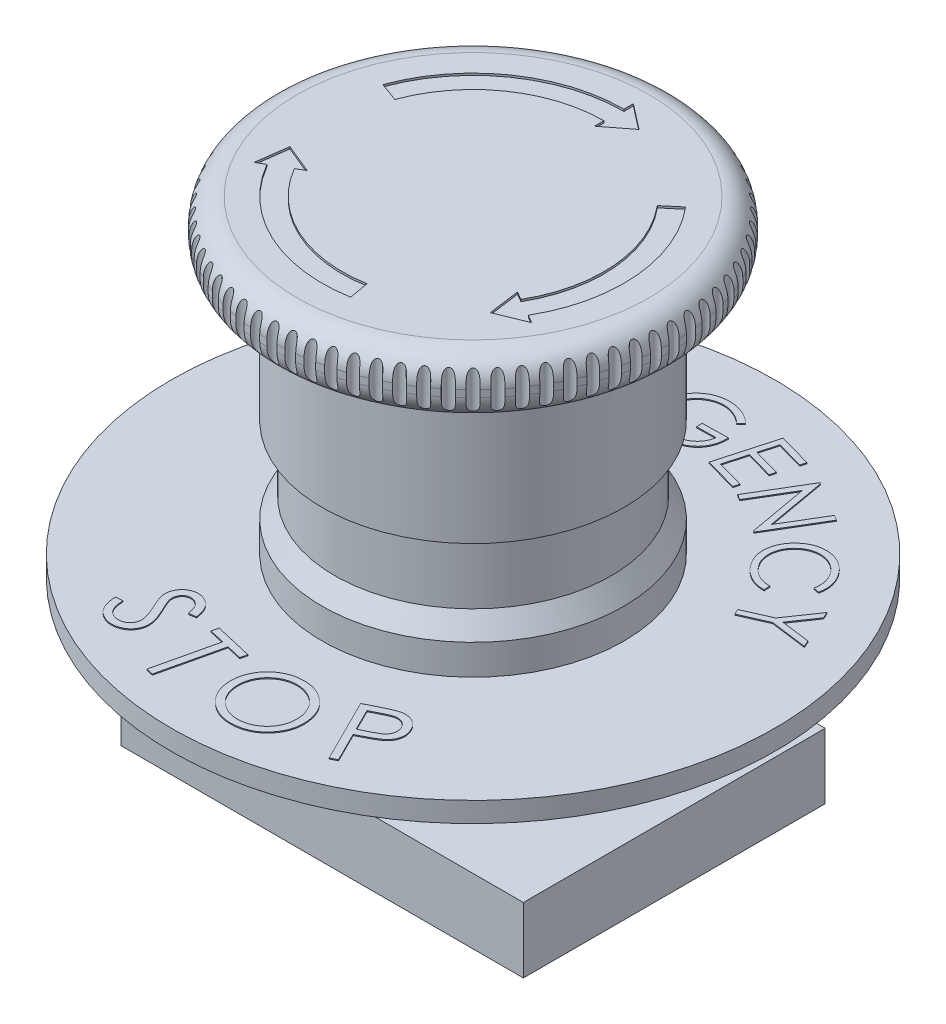
from build123d import *

# Parameters (mm, degrees)
FILLET1_R           = 2.5
CUT_EXTRUDE1_START  = -0.2
CUT_EXTRUDE1_DEPTH  = 0.2
CUT_EXTRUDE5_REACH  = 62.621
CIRPATTERN1_COUNT   = 3
SKETCH3_R           = 0.5
CUT_EXTRUDE2_DEPTH  = 10
CIRPATTERN2_COUNT   = 72
SKETCH4_R           = 0.5
CUT_EXTRUDE3_DEPTH  = 6
CIRPATTERN3_COUNT   = 60
SKETCH5_W           = 4
SKETCH5_H           = 3
CUT_EXTRUDE4_DEPTH  = 6
CIRPATTERN4_COUNT   = 3
SKETCH6_W           = 40
SKETCH6_H           = 30
BOSS_EXTRUDE1_DEPTH = 6.5
BOSS_EXTRUDE2_DEPTH = 0.1
BOSS_EXTRUDE3_DEPTH = 0.1


# Read off the part's stored shape, not the designer's step: Cut-Extrude1
with BuildPart() as part:
    # Sketch1 → Revolve1 (revolve)
    with BuildSketch(Plane.XY):
        Polygon((0, 0), (-20, 0), (-20, -5.7), (-15, -5.7), (-15, -19.3), (-13.75, -19.3), (-13.75, -25.8), (-15, -27.8), (-15, -30.8), (-30, -30.8), (-30, -32.8), (-11, -32.8), (-11, -34.8), (-15, -34.8), (-15, -40.8), (-12, -40.8), (-12, -41.8), (-11, -41.8), (-11, -43.3), (0, -43.3), align=None)
    revolve(axis=Axis((0, 0, 0), (0, -1, 0)))

    # Fillet1
    fillet1_edges = [part.edges().sort_by_distance(p)[0] for p in [
        (20, -5.7, 0),
        (20, 0, 0),
    ]]
    fillet(fillet1_edges, radius=FILLET1_R)

    # Cut-Extrude1 outline → Cut-Extrude1 (cut)
    with BuildSketch(Plane(origin=(0, 0, 0), x_dir=(1, 0, 0), z_dir=(0, 1, 0)).offset(CUT_EXTRUDE1_START)):
        with BuildLine():
            Line((0, 15.934954174), (0, 15))
            ThreePointArc((0, 15), (-8.603646545, 12.287280664), (-14.095389312, 5.13030215))
            Line((-14.095389312, 5.13030215), (-12.21600407, 4.446261863))
            ThreePointArc((-12.21600407, 4.446261863), (-7.456493673, 10.648976576), (0, 13))
            Line((0, 13), (0, 12.065045826))
            Line((0, 12.065045826), (2.5, 14))
            Line((2.5, 14), (0, 15.934954174))
        make_face()
    cut_extrude1 = extrude(amount=CUT_EXTRUDE1_DEPTH, mode=Mode.SUBTRACT)

    # Cut-Extrude5: up to this face of the body (flat: up to its plane)
    cut_extrude5_end = Plane(part.part.faces().sort_by_distance((29.151471863, -32.8, 0))[0])
    # Sketch7 → Cut-Extrude5 (cut, up to the picked face)
    with BuildSketch(Plane.XZ.offset(43.3), mode=Mode.PRIVATE) as cut_extrude5_sk1:
        with BuildLine():
            Line((-10.35, -3.725251669), (-10.35, 3.725251669))
            ThreePointArc((-10.35, 3.725251669), (-11, 0), (-10.35, -3.725251669))
        make_face()
    cut_extrude5_tool1 = split(extrude(cut_extrude5_sk1.sketch, amount=-CUT_EXTRUDE5_REACH, mode=Mode.PRIVATE), bisect_by=cut_extrude5_end, keep=Keep.BOTH, mode=Mode.PRIVATE)
    # Sketch7 → Cut-Extrude5 (cut, up to the picked face)
    with BuildSketch(Plane.XZ.offset(43.3), mode=Mode.PRIVATE) as cut_extrude5_sk2:
        with BuildLine():
            Line((10.35, -3.725251669), (10.35, 3.725251669))
            ThreePointArc((10.35, 3.725251669), (11, 0), (10.35, -3.725251669))
        make_face()
    cut_extrude5_tool2 = split(extrude(cut_extrude5_sk2.sketch, amount=-CUT_EXTRUDE5_REACH, mode=Mode.PRIVATE), bisect_by=cut_extrude5_end, keep=Keep.BOTH, mode=Mode.PRIVATE)
    add(cut_extrude5_tool1.solids().sort_by(Axis((-10.61067, -43.3, 0), (0, 1, 0)))[0], mode=Mode.SUBTRACT)
    add(cut_extrude5_tool2.solids().sort_by(Axis((10.61067, -43.3, 0), (0, 1, 0)))[0], mode=Mode.SUBTRACT)

    # CirPattern1: Cut-Extrude1 ×3 about axis
    cirpattern1_axis = Axis((0, 0, 0), (0, 1, 0))
    for i in range(1, CIRPATTERN1_COUNT):
        add(cut_extrude1.rotate(cirpattern1_axis, i * 360 / CIRPATTERN1_COUNT), mode=Mode.SUBTRACT)

    # Sketch3 → Cut-Extrude2 (cut)
    with BuildSketch(Plane(origin=(0, 0, 0), x_dir=(1, 0, 0), z_dir=(0, 1, 0))):
        with Locations((0, 20)):
            Circle(SKETCH3_R)
    cut_extrude2 = extrude(amount=-CUT_EXTRUDE2_DEPTH, mode=Mode.SUBTRACT)

    # CirPattern2: Cut-Extrude2 ×72 about axis
    cirpattern2_axis = Axis((0, 0, 0), (0, 1, 0))
    for i in range(1, CIRPATTERN2_COUNT):
        add(cut_extrude2.rotate(cirpattern2_axis, i * 360 / CIRPATTERN2_COUNT), mode=Mode.SUBTRACT)

    # Sketch4 → Cut-Extrude3 (cut)
    with BuildSketch(Plane.XZ.offset(40.8)):
        with Locations((0, 15)):
            Circle(SKETCH4_R)
    cut_extrude3 = extrude(amount=-CUT_EXTRUDE3_DEPTH, mode=Mode.SUBTRACT)

    # CirPattern3: Cut-Extrude3 ×60 about axis
    cirpattern3_axis = Axis((0, 0, 0), (0, 1, 0))
    for i in range(1, CIRPATTERN3_COUNT):
        add(cut_extrude3.rotate(cirpattern3_axis, i * 360 / CIRPATTERN3_COUNT), mode=Mode.SUBTRACT)

    # Sketch5 → Cut-Extrude4 (cut)
    with BuildSketch(Plane.XZ.offset(40.8)):
        with Locations((0, 15)):
            Rectangle(SKETCH5_W, SKETCH5_H)
    cut_extrude4 = extrude(amount=-CUT_EXTRUDE4_DEPTH, mode=Mode.SUBTRACT)

    # CirPattern4: Cut-Extrude4 ×3 about axis
    cirpattern4_axis = Axis((0, 0, 0), (0, 1, 0))
    for i in range(1, CIRPATTERN4_COUNT):
        add(cut_extrude4.rotate(cirpattern4_axis, i * 360 / CIRPATTERN4_COUNT), mode=Mode.SUBTRACT)

    # Sketch6 → Boss-Extrude1 (add)
    with BuildSketch(Plane.XZ.offset(43.3)):
        Rectangle(SKETCH6_W, SKETCH6_H)
    extrude(amount=BOSS_EXTRUDE1_DEPTH)

    # Sketch8 → Boss-Extrude2 (add)
    # profile 1 of 9: a face of its own
    with BuildSketch(Plane(origin=(0, -30.8, 0), x_dir=(1, 0, 0), z_dir=(0, 1, 0))):
        Polygon((22.727560882, 12.460487758), (23.006407036, 11.828276219), (21.369387805, 9.436449296), (24.229964728, 9.054237758), (24.508810882, 8.422026219), (20.888618575, 8.895583912), (18.274435882, 7.742939681), (18.036455113, 8.282603142), (20.650637805, 9.435247373), align=None)
    # profile 2 of 9: a face of its own
    with BuildSketch(Plane(origin=(0, -30.8, 0), x_dir=(1, 0, 0), z_dir=(0, 1, 0))):
        with BuildLine():
            Line((20.545172736, 13.787310208), (19.96464389, 13.909906362))
            add(Edge.make_bspline(
                [(19.96464389, 13.909906362), (19.983326679, 14.012957622), (20.020196857, 14.216327592), (20.02884491, 14.523745965), (20.005861256, 14.825519642), (19.954834093, 15.071831993), (19.89780064, 15.264751914), (19.845367531, 15.40680378), (19.786950657, 15.547030328), (19.718209738, 15.683684602), (19.640932728, 15.817577581), (19.555290242, 15.948630989), (19.462059043, 16.077549527), (19.393432794, 16.159502614), (19.358874659, 16.200771747)],
                knots=[0, 0, 0, 0, 1.531837108, 3.023055415, 4.488707286, 5.955814668, 6.696507836, 7.433380089, 8.172211865, 8.920028135, 9.671792873, 10.435032477, 11.211928984, 12, 12, 12, 12], degree=3))
            add(Edge.make_bspline(
                [(19.358874659, 16.200771747), (19.319764534, 16.244958269), (19.242148721, 16.332648424), (19.116512989, 16.454450548), (18.98425618, 16.565747833), (18.846982155, 16.668715224), (18.703169705, 16.761058462), (18.554567054, 16.845958911), (18.398454642, 16.91872941), (18.238619355, 16.983689283), (18.075112063, 17.037531656), (17.911049863, 17.081074632), (17.746323399, 17.112261337), (17.582162247, 17.133132185), (17.417466534, 17.141108995), (17.253188104, 17.139283472), (17.088613558, 17.124166392), (16.924767499, 17.099265604), (16.762479765, 17.063299127), (16.603169442, 17.016008205), (16.447105462, 16.958796616), (16.294903568, 16.889305653), (16.145290706, 16.810514457), (16.000381131, 16.717893213), (15.856576628, 16.61815952), (15.766190909, 16.54281683), (15.720653506, 16.504858285)],
                knots=[0, 0, 0, 0, 1.042701479, 2.069288294, 3.089308805, 4.096267449, 5.099959046, 6.108286196, 7.118749477, 8.14178886, 9.156189653, 10.159256558, 11.139748502, 12.117321014, 13.081646708, 14.051882205, 15.018674707, 16.000137866, 16.979427239, 17.954097297, 18.93540717, 19.914696543, 20.909405144, 21.92123219, 22.952691994, 24, 24, 24, 24], degree=3))
            add(Edge.make_bspline(
                [(15.720653506, 16.504858285), (15.654641031, 16.445101151), (15.52486077, 16.327618863), (15.351758298, 16.134116749), (15.204080667, 15.929373485), (15.078187008, 15.715048905), (14.978936627, 15.489174595), (14.901053555, 15.253514308), (14.848248453, 15.006881625), (14.820285911, 14.752445501), (14.814384652, 14.495589354), (14.836958531, 14.242039427), (14.881940699, 13.993614396), (14.955290735, 13.751649046), (15.051517792, 13.513996009), (15.175584802, 13.283545812), (15.321811378, 13.056511725), (15.437919739, 12.915611931), (15.497095813, 12.843800593)],
                knots=[0, 0, 0, 0, 1.041479286, 2.0475441, 3.031295287, 3.991402464, 4.950593464, 5.912793116, 6.891200925, 7.896129016, 8.904289028, 9.892443154, 10.86991821, 11.853356541, 12.845860858, 13.865154868, 14.91194955, 16, 16, 16, 16], degree=3))
            add(Edge.make_bspline(
                [(15.497095813, 12.843800593), (15.566009219, 12.767680745), (15.701534357, 12.617983417), (15.92987155, 12.423665586), (16.17261508, 12.258562042), (16.431661399, 12.124918896), (16.70473803, 12.019405025), (16.993071472, 11.945030664), (17.296147185, 11.899809297), (17.503348609, 11.89375765), (17.608874659, 11.890675593)],
                knots=[0, 0, 0, 0, 1.028140021, 2.021940653, 2.996345951, 3.964277496, 4.936595987, 5.924074518, 6.942747538, 8, 8, 8, 8], degree=3))
            Line((17.608874659, 11.890675593), (17.643730429, 11.300531362))
            add(Edge.make_bspline(
                [(17.643730429, 11.300531362), (17.583626056, 11.298915051), (17.464157685, 11.295702338), (17.285632114, 11.305344968), (17.108772043, 11.322016818), (16.934273954, 11.353779353), (16.760326627, 11.390859033), (16.588659567, 11.442530651), (16.417772853, 11.50204108), (16.249516982, 11.572988514), (16.084854623, 11.655034226), (15.923646759, 11.746627207), (15.765685903, 11.847207477), (15.613750409, 11.959640724), (15.464240684, 12.079956486), (15.321393062, 12.212848085), (15.179335098, 12.352816309), (15.091027704, 12.453796953), (15.046374659, 12.504858285)],
                knots=[0, 0, 0, 0, 0.972473338, 1.932967617, 2.890855097, 3.844697871, 4.800960732, 5.767126069, 6.743050352, 7.727911838, 8.719407467, 9.718061393, 10.726868225, 11.747292938, 12.774919797, 13.830207265, 14.902834212, 16, 16, 16, 16], degree=3))
            add(Edge.make_bspline(
                [(15.046374659, 12.504858285), (15.004973847, 12.554113181), (14.923038858, 12.651591929), (14.811080103, 12.803252534), (14.706410095, 12.95485731), (14.613699406, 13.108999287), (14.526872486, 13.262647343), (14.45299991, 13.41933738), (14.387291994, 13.577151646), (14.332957392, 13.736910886), (14.284780597, 13.896844199), (14.249570936, 14.058975015), (14.220937535, 14.222026478), (14.205044719, 14.387179978), (14.19615967, 14.553214195), (14.197156589, 14.720619181), (14.209528238, 14.889113398), (14.224127936, 15.001312619), (14.231470813, 15.057742901)],
                knots=[0, 0, 0, 0, 1.114937038, 2.206535296, 3.265851805, 4.306708869, 5.32311974, 6.323246709, 7.307163327, 8.284392244, 9.246829816, 10.2003583, 11.158150331, 12.114430853, 13.073933048, 14.03917219, 15.013807182, 16, 16, 16, 16], degree=3))
            add(Edge.make_bspline(
                [(14.231470813, 15.057742901), (14.248090833, 15.152299009), (14.281051873, 15.339823919), (14.362058535, 15.612384257), (14.464998533, 15.874890425), (14.595385655, 16.125305558), (14.746149154, 16.367279156), (14.925242252, 16.595366888), (15.124216309, 16.816477034), (15.274206337, 16.95013022), (15.350461198, 17.018079439)],
                knots=[0, 0, 0, 0, 0.997790707, 1.97883157, 2.951456285, 3.926113916, 4.911075921, 5.912063291, 6.938493935, 8, 8, 8, 8], degree=3))
            add(Edge.make_bspline(
                [(15.350461198, 17.018079439), (15.43323492, 17.086034246), (15.596140657, 17.219775094), (15.860778721, 17.385996073), (16.131711544, 17.526439427), (16.413438709, 17.633390127), (16.70338872, 17.710757134), (17.001851808, 17.758195606), (17.309166158, 17.772668682), (17.621794773, 17.759736401), (17.933595662, 17.717377207), (18.236452473, 17.643221859), (18.528366678, 17.542163103), (18.808219317, 17.4108577), (19.07516917, 17.247958595), (19.330546837, 17.057172491), (19.575058618, 16.838034199), (19.723338522, 16.672971449), (19.798778506, 16.588992901)],
                knots=[0, 0, 0, 0, 1.029061165, 2.025280033, 2.998925284, 3.959985058, 4.917066297, 5.880594682, 6.860585689, 7.871010548, 8.886214313, 9.881516199, 10.864925191, 11.852612581, 12.848473702, 13.867261507, 14.914932158, 16, 16, 16, 16], degree=3))
            add(Edge.make_bspline(
                [(19.798778506, 16.588992901), (19.843126523, 16.536243368), (19.930857458, 16.431892237), (20.049260673, 16.267666034), (20.157734627, 16.101731664), (20.255892111, 15.93333808), (20.340816201, 15.761067087), (20.415959784, 15.586307484), (20.479386722, 15.408373214), (20.532673712, 15.228350081), (20.572997744, 15.047092098), (20.603421779, 14.865779708), (20.62291119, 14.685179955), (20.629747212, 14.504515905), (20.626721229, 14.324633001), (20.610391515, 14.144886869), (20.584544539, 13.965355329), (20.558342108, 13.846864055), (20.545172736, 13.787310208)],
                knots=[0, 0, 0, 0, 1.097129198, 2.170382686, 3.221543189, 4.253494677, 5.272126005, 6.278272624, 7.281258565, 8.278607594, 9.266133113, 10.236359277, 11.205157895, 12.156573366, 13.113789944, 14.068046391, 15.028997966, 16, 16, 16, 16], degree=3))
        make_face()
    # profile 3 of 9: a face of its own
    with BuildSketch(Plane(origin=(0, -30.8, 0), x_dir=(1, 0, 0), z_dir=(0, 1, 0))):
        Polygon((8.132120265, 18.162872224), (11.207841418, 23.301093378), (11.319620265, 23.233785685), (12.380918342, 17.256622224), (14.735485649, 21.189314531), (15.242697188, 20.885227993), (12.166976034, 15.747006839), (12.051591418, 15.816718378), (10.989091418, 21.728977993), (8.663370265, 17.844362608), align=None)
    # profile 4 of 9: a face of its own
    with BuildSketch(Plane(origin=(0, -30.8, 0), x_dir=(1, 0, 0), z_dir=(0, 1, 0))):
        Polygon((5.534579878, 25.28900762), (8.827849109, 24.362324928), (8.669195263, 23.796219158), (5.950445263, 24.560642235), (5.444435647, 22.763767235), (8.139147186, 22.006555697), (7.981695263, 21.444055697), (5.286983724, 22.201267235), (4.65236834, 19.946459543), (7.347079878, 19.189248005), (7.188426032, 18.623142235), (3.919195263, 19.542613389), align=None)
    # profile 5 of 9: a face of its own
    with BuildSketch(Plane(origin=(0, -30.8, 0), x_dir=(1, 0, 0), z_dir=(0, 1, 0))):
        with BuildLine():
            Line((2.415007403, 24.690552498), (1.961882403, 24.244639036))
            add(Edge.make_bspline(
                [(1.961882403, 24.244639036), (1.876335867, 24.321649294), (1.708180307, 24.473025418), (1.434606461, 24.668655641), (1.151063208, 24.8351032), (0.857950985, 24.970257451), (0.562433704, 25.076521998), (0.268056216, 25.149764114), (-0.02228171, 25.194587624), (-0.214646216, 25.197517442), (-0.309752213, 25.198965959)],
                knots=[0, 0, 0, 0, 1.093719991, 2.149883634, 3.191318574, 4.215648269, 5.214500914, 6.172598825, 7.0965235, 8, 8, 8, 8], degree=3))
            add(Edge.make_bspline(
                [(-0.309752213, 25.198965959), (-0.367896472, 25.196936565), (-0.483673697, 25.192895623), (-0.655893585, 25.173066022), (-0.825715446, 25.143116524), (-0.993147796, 25.102169654), (-1.158419019, 25.050049998), (-1.321614147, 24.987969118), (-1.482280846, 24.913839245), (-1.639527317, 24.830320972), (-1.79201568, 24.738760366), (-1.935087876, 24.637026543), (-2.070103133, 24.529262897), (-2.195296557, 24.413101328), (-2.312723029, 24.290692527), (-2.419379849, 24.158933911), (-2.518324463, 24.020830698), (-2.607064028, 23.875785509), (-2.684487917, 23.725414032), (-2.7535796, 23.573427296), (-2.809990874, 23.418966245), (-2.855823269, 23.262733985), (-2.892396103, 23.104763396), (-2.915903438, 22.944368222), (-2.929896201, 22.782558217), (-2.929928352, 22.674154379), (-2.92994452, 22.619639036)],
                knots=[0, 0, 0, 0, 1.026082329, 2.043141775, 3.055301837, 4.066745937, 5.081666351, 6.110811546, 7.145041362, 8.201116278, 9.250880547, 10.280438288, 11.295998425, 12.296391959, 13.29130206, 14.28593594, 15.284254822, 16.28676855, 17.282607196, 18.266534916, 19.230327222, 20.180861924, 21.137656846, 22.088296662, 23.038621104, 24, 24, 24, 24], degree=3))
            add(Edge.make_bspline(
                [(-2.92994452, 22.619639036), (-2.92802964, 22.563883056), (-2.924215364, 22.452821961), (-2.902669093, 22.287874849), (-2.871914312, 22.124654211), (-2.828064936, 21.964368856), (-2.775295473, 21.805446962), (-2.710304726, 21.649750284), (-2.633982676, 21.496001827), (-2.546892733, 21.345838692), (-2.45001678, 21.200679076), (-2.343540605, 21.063354032), (-2.230015284, 20.9331979), (-2.106177663, 20.812883823), (-1.97529241, 20.699084425), (-1.834431356, 20.59521474), (-1.68619458, 20.498426289), (-1.530268211, 20.411187213), (-1.368281741, 20.332848899), (-1.201402837, 20.266144249), (-1.03121072, 20.20848678), (-0.856842042, 20.165155814), (-0.679688756, 20.129643071), (-0.498672095, 20.10535585), (-0.313923808, 20.093704831), (-0.189573395, 20.093366709), (-0.127059905, 20.093196728)],
                knots=[0, 0, 0, 0, 0.956776184, 1.905815506, 2.850937646, 3.804795088, 4.754804964, 5.722533489, 6.697123525, 7.698194073, 8.699193805, 9.689227377, 10.678042946, 11.660024214, 12.649508676, 13.651829486, 14.660518928, 15.685475604, 16.715514723, 17.745714415, 18.767461491, 19.796215127, 20.826254245, 21.866565476, 22.92747893, 24, 24, 24, 24], degree=3))
            add(Edge.make_bspline(
                [(-0.127059905, 20.093196728), (-0.051639403, 20.095912468), (0.096528425, 20.101247691), (0.313468409, 20.131173294), (0.521522188, 20.175069213), (0.72010844, 20.236623555), (0.90989018, 20.313912089), (1.090586893, 20.406593326), (1.262462503, 20.514999362), (1.422228025, 20.640294702), (1.571647179, 20.7759809), (1.703286128, 20.924329136), (1.820483042, 21.0805819), (1.919952957, 21.246660723), (2.004125173, 21.422262086), (2.068937811, 21.60762171), (2.121402244, 21.801443138), (2.140744319, 21.935071142), (2.150584326, 22.003052498)],
                knots=[0, 0, 0, 0, 1.111322291, 2.18325531, 3.221787674, 4.241238233, 5.242044044, 6.237333614, 7.229730685, 8.231006411, 9.225297705, 10.19935501, 11.148555009, 12.09914895, 13.047044863, 14.012334143, 14.988803126, 16, 16, 16, 16], degree=3))
            Line((2.150584326, 22.003052498), (0.247940095, 21.966994805))
            Line((0.247940095, 21.966994805), (0.237122787, 22.542715959))
            Line((0.237122787, 22.542715959), (2.809238172, 22.591994805))
            add(Edge.make_bspline(
                [(2.809238172, 22.591994805), (2.808337059, 22.479724076), (2.806575428, 22.260240381), (2.77193307, 21.939389359), (2.714392314, 21.63521633), (2.627943666, 21.349030915), (2.519279326, 21.079154689), (2.382335011, 20.827276367), (2.218924517, 20.593529917), (2.033071612, 20.377061515), (1.825237093, 20.182227455), (1.597572522, 20.011944224), (1.353048714, 19.865596038), (1.089417634, 19.746352259), (0.809338941, 19.651146108), (0.51077164, 19.583460212), (0.195588585, 19.537898807), (-0.021131557, 19.529154919), (-0.131867597, 19.524687113)],
                knots=[0, 0, 0, 0, 1.123271213, 2.195939376, 3.225495687, 4.21770229, 5.183624953, 6.132945456, 7.080807812, 8.033443192, 8.983948907, 9.92639992, 10.874168946, 11.83072162, 12.817401472, 13.830104492, 14.891263015, 16, 16, 16, 16], degree=3))
            add(Edge.make_bspline(
                [(-0.131867597, 19.524687113), (-0.199983165, 19.524014852), (-0.334688775, 19.522685385), (-0.534107021, 19.532399443), (-0.728037708, 19.552388702), (-0.916819972, 19.577793025), (-1.100519154, 19.614365329), (-1.278712975, 19.659563451), (-1.451785572, 19.714468084), (-1.620031592, 19.776116594), (-1.782558596, 19.848943347), (-1.940236194, 19.929547879), (-2.093270958, 20.01817633), (-2.240344156, 20.11732338), (-2.381553978, 20.225428502), (-2.518323314, 20.341352786), (-2.649815607, 20.466350054), (-2.732142915, 20.556241082), (-2.77369452, 20.60161019)],
                knots=[0, 0, 0, 0, 1.10830844, 2.191795069, 3.246598796, 4.280154492, 5.290229273, 6.292722341, 7.27007637, 8.243726883, 9.206865609, 10.166135182, 11.124407305, 12.082745958, 13.050265661, 14.016928346, 14.99911934, 16, 16, 16, 16], degree=3))
            add(Edge.make_bspline(
                [(-2.77369452, 20.60161019), (-2.834306001, 20.67350574), (-2.954042481, 20.815533619), (-3.108962132, 21.044199387), (-3.242294451, 21.280706005), (-3.352223608, 21.52642293), (-3.437445084, 21.781916316), (-3.50158814, 22.045486165), (-3.541919552, 22.318370719), (-3.549773105, 22.503321275), (-3.553742597, 22.596802498)],
                knots=[0, 0, 0, 0, 1.030383601, 2.035497289, 3.022734579, 4.003904648, 4.981775465, 5.971491611, 6.974712762, 8, 8, 8, 8], degree=3))
            add(Edge.make_bspline(
                [(-3.553742597, 22.596802498), (-3.553851536, 22.666936935), (-3.554067845, 22.806195599), (-3.538331875, 23.013523992), (-3.507557638, 23.216844606), (-3.466041401, 23.417501193), (-3.409368872, 23.614201243), (-3.339080185, 23.807570599), (-3.256109935, 23.99751022), (-3.160542271, 24.183237241), (-3.052018309, 24.361697364), (-2.935033027, 24.532971829), (-2.805575012, 24.692905285), (-2.667160897, 24.843537329), (-2.518910044, 24.984871227), (-2.359890262, 25.115694962), (-2.191090203, 25.237668521), (-2.012777336, 25.348863155), (-1.826048435, 25.448768875), (-1.632676921, 25.53672338), (-1.432427221, 25.610977199), (-1.226343613, 25.674080355), (-1.013441176, 25.723208574), (-0.794160976, 25.758681509), (-0.569106663, 25.783746942), (-0.416789077, 25.788906262), (-0.33980029, 25.791514036)],
                knots=[0, 0, 0, 0, 0.998414473, 1.982447874, 2.957059859, 3.924886112, 4.898144736, 5.869043008, 6.852613272, 7.847697293, 8.840751463, 9.825032883, 10.798843104, 11.767828803, 12.736276961, 13.712873816, 14.697700659, 15.69971063, 16.702759424, 17.711244486, 18.722147014, 19.741784762, 20.778279785, 21.830573905, 22.903465515, 24, 24, 24, 24], degree=3))
            add(Edge.make_bspline(
                [(-0.33980029, 25.791514036), (-0.276895345, 25.791578092), (-0.152225004, 25.791705043), (0.033565921, 25.783730635), (0.216382965, 25.765146408), (0.39708385, 25.739379235), (0.574810225, 25.702306154), (0.750582174, 25.660125479), (0.922754708, 25.606380415), (1.093032623, 25.545181022), (1.26143991, 25.473961886), (1.4292684, 25.393224966), (1.595870443, 25.301691946), (1.76225334, 25.200754659), (1.927177488, 25.088354387), (2.091341543, 24.965767517), (2.255550764, 24.833743968), (2.36135392, 24.738733126), (2.415007403, 24.690552498)],
                knots=[0, 0, 0, 0, 0.991372675, 1.964786236, 2.929229189, 3.886514267, 4.840043471, 5.789550034, 6.734278567, 7.681051763, 8.640354742, 9.614689466, 10.61501047, 11.635124537, 12.680678298, 13.759175515, 14.863663025, 16, 16, 16, 16], degree=3))
        make_face()
    # profile 6 of 9: a face of its own
    with BuildSketch(Plane(origin=(0, -30.8, 0), x_dir=(1, 0, 0), z_dir=(0, 1, 0))):
        with BuildLine():
            Line((-9.962269387, 23.852661761), (-8.839673233, 24.232469453))
            add(Edge.make_bspline(
                [(-8.839673233, 24.232469453), (-8.764392099, 24.257427975), (-8.62043918, 24.305153771), (-8.413069233, 24.371827673), (-8.223808373, 24.429065127), (-8.052670576, 24.479217272), (-7.899570343, 24.519084345), (-7.764223674, 24.54855543), (-7.647980271, 24.573165181), (-7.575722102, 24.581869008), (-7.542798233, 24.585834838)],
                knots=[0, 0, 0, 0, 1.41401025, 2.703876705, 3.883389485, 4.939117467, 5.883308228, 6.703003456, 7.409033675, 8, 8, 8, 8], degree=3))
            add(Edge.make_bspline(
                [(-7.542798233, 24.585834838), (-7.498358538, 24.589285246), (-7.410364548, 24.596117318), (-7.279279812, 24.594981991), (-7.151124283, 24.582649285), (-7.026128048, 24.561111229), (-6.90408521, 24.530079408), (-6.785517077, 24.487530444), (-6.670319243, 24.434487811), (-6.558424172, 24.372045883), (-6.452006111, 24.300457885), (-6.352418556, 24.219763866), (-6.262890376, 24.128703881), (-6.17827958, 24.031211193), (-6.104785016, 23.922767672), (-6.038063437, 23.806280292), (-5.978792133, 23.68147285), (-5.947111546, 23.593341536), (-5.931019387, 23.548575222)],
                knots=[0, 0, 0, 0, 1.027427978, 2.034385874, 3.017935905, 3.992946048, 4.956378125, 5.917682049, 6.89321719, 7.877504434, 8.869047601, 9.847247129, 10.827059231, 11.810001731, 12.819583351, 13.841640044, 14.903660747, 16, 16, 16, 16], degree=3))
            add(Edge.make_bspline(
                [(-5.931019387, 23.548575222), (-5.90803927, 23.472966239), (-5.863281286, 23.325703899), (-5.833311656, 23.099976302), (-5.835630181, 22.879450854), (-5.868867164, 22.664541953), (-5.934633811, 22.459527765), (-6.028269836, 22.265075419), (-6.158068685, 22.088033099), (-6.285816029, 21.949814333), (-6.407137265, 21.848990113), (-6.509399172, 21.772868607), (-6.623446142, 21.699759136), (-6.749974694, 21.630539272), (-6.886193053, 21.560095039), (-7.035628418, 21.494896942), (-7.195700243, 21.431109147), (-7.306696113, 21.39119396), (-7.363711695, 21.370690607)],
                knots=[0, 0, 0, 0, 1.278488734, 2.490090921, 3.67138021, 4.840843049, 5.998504165, 7.147930924, 8.320379523, 9.541677452, 10.186531204, 10.873206319, 11.605939088, 12.378791867, 13.208929891, 14.089328545, 15.018539673, 16, 16, 16, 16], degree=3))
            Line((-7.363711695, 21.370690607), (-4.449048233, 19.436796376))
            Line((-4.449048233, 19.436796376), (-5.147365541, 19.201219453))
            Line((-5.147365541, 19.201219453), (-8.05722131, 21.136315607))
            Line((-8.05722131, 21.136315607), (-8.378134772, 21.02814253))
            Line((-8.378134772, 21.02814253), (-7.491115541, 18.407950222))
            Line((-7.491115541, 18.407950222), (-8.054817464, 18.216844453))
            Line((-8.054817464, 18.216844453), (-9.962269387, 23.852661761))
        make_face()
        with BuildLine():
            Line((-9.212269387, 23.492084838), (-8.563230925, 21.576219453))
            Line((-8.563230925, 21.576219453), (-7.592077079, 21.895930992))
            add(Edge.make_bspline(
                [(-7.592077079, 21.895930992), (-7.546700851, 21.911675226), (-7.45914468, 21.942054675), (-7.333900645, 21.990650346), (-7.218228107, 22.037747879), (-7.113993024, 22.087967976), (-7.018380363, 22.134983746), (-6.934325103, 22.184410967), (-6.860485869, 22.233810331), (-6.776210471, 22.298507184), (-6.686687073, 22.386178445), (-6.598324536, 22.502889449), (-6.531982697, 22.63155799), (-6.486349911, 22.769495963), (-6.460990618, 22.912921177), (-6.458083445, 23.058958327), (-6.473454598, 23.206087671), (-6.502714267, 23.300937952), (-6.517557848, 23.349055992)],
                knots=[0, 0, 0, 0, 1.118467517, 2.158150547, 3.128534135, 4.025923606, 4.852143847, 5.609074423, 6.294858494, 6.920079087, 8.081356054, 9.201029425, 10.315285712, 11.436513106, 12.573202181, 13.693225395, 14.829761277, 16, 16, 16, 16], degree=3))
            add(Edge.make_bspline(
                [(-6.517557848, 23.349055992), (-6.535198621, 23.394458886), (-6.570026527, 23.484097127), (-6.642857886, 23.608773447), (-6.735539535, 23.718180317), (-6.842060252, 23.814479803), (-6.960709626, 23.893000021), (-7.086653709, 23.954948066), (-7.220569545, 23.993202122), (-7.337612289, 24.008313305), (-7.437531645, 24.010098384), (-7.522311668, 24.003544374), (-7.616058738, 23.989741595), (-7.719098564, 23.970483645), (-7.831432343, 23.945123078), (-7.95284858, 23.91242509), (-8.083701219, 23.872473166), (-8.173863996, 23.842819595), (-8.220682848, 23.827421376)],
                knots=[0, 0, 0, 0, 1.157352423, 2.284943173, 3.414665668, 4.554947293, 5.688681029, 6.788224356, 7.879811883, 8.984873758, 9.585246142, 10.253941905, 11.004520797, 11.838034865, 12.746498182, 13.742672944, 14.827837104, 16, 16, 16, 16], degree=3))
            Line((-8.220682848, 23.827421376), (-9.212269387, 23.492084838))
        make_face(mode=Mode.SUBTRACT)
    # profile 7 of 9: a face of its own
    with BuildSketch(Plane(origin=(0, -30.8, 0), x_dir=(1, 0, 0), z_dir=(0, 1, 0))):
        Polygon((-15.10234044, 21.008448696), (-12.221330824, 22.836573696), (-11.907628901, 22.341381388), (-14.286234671, 20.831766004), (-13.288638517, 19.259650619), (-10.93046544, 20.75604485), (-10.61796544, 20.263256388), (-12.976138517, 18.766862157), (-11.723734671, 16.794506388), (-9.365561594, 18.290900619), (-9.051859671, 17.795708311), (-11.912436594, 15.980804465), align=None)
    # profile 8 of 9: a face of its own
    with BuildSketch(Plane(origin=(0, -30.8, 0), x_dir=(1, 0, 0), z_dir=(0, 1, 0))):
        Polygon((-17.133003053, 10.161617494), (-21.11617613, 14.64839634), (-21.05367613, 14.721713648), (-15.776031899, 13.410415571), (-17.945503053, 18.38637711), (-17.88180113, 18.46089634), (-12.801272283, 15.268588648), (-13.179878053, 14.821473264), (-16.796464591, 17.126761725), (-14.914253053, 12.77700211), (-15.010406899, 12.662819417), (-19.652233822, 13.80825211), (-16.761608822, 10.599117494), align=None)
    # profile 9 of 9: a face of its own
    with BuildSketch(Plane(origin=(0, -30.8, 0), x_dir=(1, 0, 0), z_dir=(0, 1, 0))):
        Polygon((-24.350638263, 8.711229417), (-23.020109417, 11.845844801), (-22.480445955, 11.617479417), (-23.579003647, 9.029739032), (-21.868667109, 8.303777494), (-20.779724801, 10.86868134), (-20.244869032, 10.641517878), (-21.33381134, 8.076614032), (-19.188378647, 7.166758263), (-18.09943634, 9.731662109), (-17.559772878, 9.502094801), (-18.88068634, 6.390315955), align=None)
    extrude(amount=BOSS_EXTRUDE2_DEPTH)

    # Sketch9 → Boss-Extrude3 (add)
    # profile 1 of 4: a face of its own
    with BuildSketch(Plane(origin=(0, -30.8, 0), x_dir=(1, 0, 0), z_dir=(0, 1, 0))):
        with BuildLine():
            Line((-13.964029916, -21.565038339), (-13.271321582, -21.525775519))
            add(Edge.make_bspline(
                [(-13.271321582, -21.525775519), (-13.268069344, -21.630618051), (-13.261847389, -21.831195488), (-13.223079355, -22.117310247), (-13.166563156, -22.375793527), (-13.083370783, -22.604565487), (-12.980154501, -22.80564288), (-12.851968164, -22.976294156), (-12.702640583, -23.120839647), (-12.58531578, -23.190506808), (-12.526730236, -23.22529475)],
                knots=[0, 0, 0, 0, 1.291195189, 2.470224809, 3.551207894, 4.543825079, 5.460614922, 6.324213895, 7.16320473, 8, 8, 8, 8], degree=3))
            add(Edge.make_bspline(
                [(-12.526730236, -23.22529475), (-12.474445508, -23.250413815), (-12.370811392, -23.300202582), (-12.206762739, -23.351978495), (-12.038179244, -23.383321958), (-11.867171243, -23.392722112), (-11.697956921, -23.382131301), (-11.536322366, -23.349719812), (-11.383516134, -23.298138001), (-11.243917491, -23.222717985), (-11.115886729, -23.132030791), (-11.003977321, -23.025830673), (-10.904258212, -22.909266477), (-10.853916603, -22.820961697), (-10.828613249, -22.776576801)],
                knots=[0, 0, 0, 0, 1.067693606, 2.116286859, 3.158494843, 4.219498748, 5.263839493, 6.273846108, 7.248880291, 8.22357211, 9.186666649, 10.131058542, 11.060608361, 12, 12, 12, 12], degree=3))
            add(Edge.make_bspline(
                [(-10.828613249, -22.776576801), (-10.803766185, -22.723533494), (-10.753367297, -22.615942364), (-10.713172531, -22.438852087), (-10.698330086, -22.25019954), (-10.710255822, -22.122155034), (-10.716433762, -22.055823596)],
                knots=[0, 0, 0, 0, 0.946611364, 1.920072322, 2.92252626, 4, 4, 4, 4], degree=3))
            add(Edge.make_bspline(
                [(-10.716433762, -22.055823596), (-10.72373881, -22.00662676), (-10.739141117, -21.902897837), (-10.776955107, -21.741621664), (-10.82560249, -21.566960687), (-10.888661325, -21.379966838), (-10.961356903, -21.179113565), (-11.047024436, -20.964968686), (-11.145424192, -20.738029201), (-11.216721906, -20.583326475), (-11.253493057, -20.503539942)],
                knots=[0, 0, 0, 0, 0.723915924, 1.526338363, 2.409784336, 3.363205691, 4.398785749, 5.519784013, 6.720851022, 8, 8, 8, 8], degree=3))
            add(Edge.make_bspline(
                [(-11.253493057, -20.503539942), (-11.29003705, -20.424119174), (-11.359988255, -20.272094777), (-11.458711501, -20.053988613), (-11.542914691, -19.855287084), (-11.613162027, -19.675912112), (-11.672629908, -19.517446662), (-11.717909189, -19.377545804), (-11.751224906, -19.257892407), (-11.764823382, -19.183660485), (-11.770920941, -19.150374878)],
                knots=[0, 0, 0, 0, 1.444892849, 2.76576227, 3.956622197, 5.010998608, 5.94951981, 6.753258476, 7.440960884, 8, 8, 8, 8], degree=3))
            add(Edge.make_bspline(
                [(-11.770920941, -19.150374878), (-11.777614613, -19.099961608), (-11.790779921, -19.000807317), (-11.799672014, -18.852737401), (-11.795716714, -18.707697748), (-11.778012199, -18.565832659), (-11.752039427, -18.42684677), (-11.713918545, -18.291126634), (-11.663403843, -18.15886596), (-11.621124744, -18.07406281), (-11.599847223, -18.031384493)],
                knots=[0, 0, 0, 0, 1.0588438, 2.082564917, 3.085576218, 4.075609315, 5.056846643, 6.027550733, 7.007338598, 8, 8, 8, 8], degree=3))
            add(Edge.make_bspline(
                [(-11.599847223, -18.031384493), (-11.562735936, -17.966703761), (-11.489502385, -17.839066048), (-11.351657694, -17.668974091), (-11.195798229, -17.519260252), (-11.020806207, -17.393774431), (-10.830793692, -17.292416489), (-10.629217331, -17.21696269), (-10.416500023, -17.172367062), (-10.196401199, -17.156023056), (-9.973430445, -17.16678978), (-9.753330782, -17.207145633), (-9.536960047, -17.272012663), (-9.401255617, -17.338569135), (-9.332419339, -17.372330006)],
                knots=[0, 0, 0, 0, 1.017833641, 2.008541841, 2.980011157, 3.964002614, 4.941419073, 5.915678014, 6.89549238, 7.90138763, 8.92479936, 9.937306361, 10.953695526, 12, 12, 12, 12], degree=3))
            add(Edge.make_bspline(
                [(-9.332419339, -17.372330006), (-9.262094672, -17.412626293), (-9.122150858, -17.492814602), (-8.933362918, -17.64410927), (-8.768021325, -17.820869971), (-8.646866139, -17.985748476), (-8.561144981, -18.132193116), (-8.502745369, -18.255685933), (-8.446440446, -18.389592896), (-8.395990637, -18.53622839), (-8.351629858, -18.695165386), (-8.311096842, -18.866402485), (-8.274709937, -19.049773607), (-8.254601328, -19.176476263), (-8.244278313, -19.241520711)],
                knots=[0, 0, 0, 0, 1.291728918, 2.570498791, 3.841854178, 5.144002681, 5.825724203, 6.546155278, 7.321714816, 8.142424834, 9.0182374, 9.95337847, 10.949340336, 12, 12, 12, 12], degree=3))
            Line((-8.244278313, -19.241520711), (-8.951009082, -19.357906929))
            add(Edge.make_bspline(
                [(-8.951009082, -19.357906929), (-8.959565593, -19.305967412), (-8.976109108, -19.205545375), (-9.005349941, -19.060960164), (-9.038113035, -18.928507467), (-9.069627863, -18.806924081), (-9.104524109, -18.697297097), (-9.142533659, -18.599215872), (-9.181063047, -18.512178162), (-9.235442134, -18.412917935), (-9.312688915, -18.302581042), (-9.420827318, -18.186247797), (-9.544061724, -18.084418471), (-9.636320196, -18.031503695), (-9.682980236, -18.004741865)],
                knots=[0, 0, 0, 0, 1.18151419, 2.284388973, 3.309893745, 4.243889072, 5.103246753, 5.890402539, 6.604145343, 7.238002648, 8.428427048, 9.61625954, 10.794415029, 12, 12, 12, 12], degree=3))
            add(Edge.make_bspline(
                [(-9.682980236, -18.004741865), (-9.744279198, -17.975868313), (-9.862606219, -17.920132926), (-10.050226118, -17.87499851), (-10.236006448, -17.870971533), (-10.415284625, -17.903783372), (-10.582702738, -17.9672708), (-10.730329254, -18.063310755), (-10.855676398, -18.188977434), (-10.91665273, -18.290710029), (-10.947803954, -18.34268257)],
                knots=[0, 0, 0, 0, 1.110031481, 2.142723358, 3.140254954, 4.13790453, 5.116616455, 6.059216396, 7.008504065, 8, 8, 8, 8], degree=3))
            add(Edge.make_bspline(
                [(-10.947803954, -18.34268257), (-10.964473924, -18.376464756), (-10.997967391, -18.444340251), (-11.034062893, -18.552272299), (-11.057298988, -18.664376857), (-11.072671151, -18.781097939), (-11.072020221, -18.907337142), (-11.055297904, -19.044675999), (-11.026149654, -19.19538604), (-10.995916362, -19.298305154), (-10.980055557, -19.352297955)],
                knots=[0, 0, 0, 0, 0.869172492, 1.746349812, 2.618532724, 3.510133611, 4.459936869, 5.524314621, 6.701220982, 8, 8, 8, 8], degree=3))
            add(Edge.make_bspline(
                [(-10.980055557, -19.352297955), (-10.973100654, -19.371015197), (-10.956501882, -19.415686309), (-10.925754558, -19.493281822), (-10.881321122, -19.590635736), (-10.828217673, -19.710577466), (-10.764140815, -19.851477942), (-10.687556507, -20.013270413), (-10.601408345, -20.196408106), (-10.538961731, -20.325057095), (-10.506097223, -20.392762698)],
                knots=[0, 0, 0, 0, 0.41903214, 1.000074219, 1.751008207, 2.664280752, 3.752880856, 4.999061839, 6.420661279, 8, 8, 8, 8], degree=3))
            add(Edge.make_bspline(
                [(-10.506097223, -20.392762698), (-10.466801052, -20.475264908), (-10.390685038, -20.635070284), (-10.288373319, -20.870812649), (-10.199529722, -21.093727482), (-10.124994947, -21.304794533), (-10.062831899, -21.503356732), (-10.014563722, -21.690024748), (-9.980917304, -21.864292428), (-9.958603556, -22.027206986), (-9.951199325, -22.181461597), (-9.950386932, -22.329413306), (-9.960173042, -22.472838014), (-9.980024592, -22.611417023), (-10.007775878, -22.745627375), (-10.045657887, -22.874600078), (-10.093208503, -22.999071781), (-10.132888498, -23.077900829), (-10.152731839, -23.117321993)],
                knots=[0, 0, 0, 0, 1.537009856, 2.977161926, 4.321800635, 5.572578444, 6.741374698, 7.82067114, 8.813673419, 9.725482297, 10.583756668, 11.409284982, 12.213113018, 12.999212519, 13.762491589, 14.516317922, 15.258033974, 16, 16, 16, 16], degree=3))
            add(Edge.make_bspline(
                [(-10.152731839, -23.117321993), (-10.1834296, -23.171754284), (-10.244045587, -23.27923662), (-10.353174034, -23.427371263), (-10.475580058, -23.561170496), (-10.611480425, -23.680706724), (-10.758795698, -23.788686152), (-10.921739579, -23.878948235), (-11.095657677, -23.958386921), (-11.281013572, -24.020340754), (-11.471935094, -24.066461527), (-11.663890092, -24.095114706), (-11.855087938, -24.103168963), (-12.044447003, -24.093924203), (-12.232892246, -24.063975667), (-12.419423668, -24.014092124), (-12.605974708, -23.947471411), (-12.725463942, -23.887939346), (-12.7861453, -23.857706609)],
                knots=[0, 0, 0, 0, 0.986762363, 1.948467023, 2.899906516, 3.84694962, 4.804305033, 5.779975922, 6.784897802, 7.821931831, 8.862746453, 9.885345444, 10.88343132, 11.8818724, 12.876371819, 13.89214636, 14.929548551, 16, 16, 16, 16], degree=3))
            add(Edge.make_bspline(
                [(-12.7861453, -23.857706609), (-12.832366801, -23.832223727), (-12.923451079, -23.782007058), (-13.051976727, -23.69515868), (-13.172439994, -23.601519891), (-13.284863482, -23.500258146), (-13.389472337, -23.392004245), (-13.484831977, -23.274695079), (-13.573268956, -23.150591496), (-13.652430865, -23.017367239), (-13.722793475, -22.874893071), (-13.78471381, -22.721787023), (-13.836312385, -22.556545122), (-13.879282265, -22.380351743), (-13.914409618, -22.192653681), (-13.941006514, -21.993775578), (-13.957570642, -21.783109114), (-13.961841603, -21.638917705), (-13.964029916, -21.565038339)],
                knots=[0, 0, 0, 0, 0.930169089, 1.832994971, 2.731409532, 3.618374493, 4.498459929, 5.382702545, 6.281306067, 7.183002898, 8.111747168, 9.080435499, 10.091690857, 11.161015425, 12.276256598, 13.456900075, 14.696991665, 16, 16, 16, 16], degree=3))
        make_face()
    # profile 2 of 4: a face of its own
    with BuildSketch(Plane(origin=(0, -30.8, 0), x_dir=(1, 0, 0), z_dir=(0, 1, 0))):
        Polygon((-6.298301647, -19.751149886), (-6.145457096, -19.093497642), (-2.43231607, -19.957279693), (-2.585160621, -20.614931937), (-4.093974724, -20.264371039), (-5.515849724, -26.375348604), (-6.20575357, -26.214090591), (-4.78387857, -20.103113027), align=None)
    # profile 3 of 4: a face of its own
    with BuildSketch(Plane(origin=(0, -30.8, 0), x_dir=(1, 0, 0), z_dir=(0, 1, 0))):
        with BuildLine():
            add(Edge.make_bspline(
                [(2.156603476, -19.434977254), (2.285038254, -19.423689257), (2.537430928, -19.401506731), (2.91211007, -19.409935286), (3.274558304, -19.448916553), (3.624279865, -19.527488291), (3.962147486, -19.638318999), (4.288064486, -19.783442525), (4.601029879, -19.964572244), (4.897975035, -20.177726473), (5.174817021, -20.415773265), (5.423131942, -20.676269248), (5.639904884, -20.956526041), (5.826131946, -21.254984191), (5.980347685, -21.572621448), (6.099610361, -21.909840497), (6.193576532, -22.264626444), (6.227096968, -22.510075705), (6.24414354, -22.634897125)],
                knots=[0, 0, 0, 0, 1.067614543, 2.098014985, 3.099693335, 4.083534878, 5.062117569, 6.041688446, 7.034174891, 8.05303938, 9.066293908, 10.055245008, 11.029803374, 11.99703079, 12.965327693, 13.949077753, 14.957018543, 16, 16, 16, 16], degree=3))
            add(Edge.make_bspline(
                [(6.24414354, -22.634897125), (6.254905218, -22.759123238), (6.276124269, -23.004062743), (6.266988238, -23.368677978), (6.223538102, -23.722277558), (6.146318288, -24.065470762), (6.033389732, -24.39817296), (5.885215053, -24.720135637), (5.703353842, -25.031744065), (5.488430318, -25.327906428), (5.247929853, -25.603223492), (4.987478955, -25.852350136), (4.707578111, -26.069324075), (4.408601746, -26.2534641), (4.092263605, -26.407827489), (3.757606673, -26.529377084), (3.404448415, -26.620873755), (3.161054097, -26.654729999), (3.03721245, -26.67195642)],
                knots=[0, 0, 0, 0, 1.041796725, 2.054134742, 3.042392644, 4.015955832, 4.989691528, 5.974110198, 6.97404169, 8.001114327, 9.028543706, 10.02632741, 11.009589834, 11.983396093, 12.956825958, 13.947021026, 14.955422218, 16, 16, 16, 16], degree=3))
            add(Edge.make_bspline(
                [(3.03721245, -26.67195642), (2.911587603, -26.683349264), (2.663879028, -26.70581381), (2.295593694, -26.695703411), (1.938116586, -26.654433851), (1.592048144, -26.577329879), (1.25782644, -26.463993743), (0.934510472, -26.317212039), (0.622792884, -26.135606982), (0.326041916, -25.921879158), (0.050233885, -25.682754957), (-0.197647911, -25.422934512), (-0.413975215, -25.144909521), (-0.598112328, -24.849097251), (-0.752574135, -24.536204627), (-0.872331472, -24.20481522), (-0.964142839, -23.856621843), (-0.998049597, -23.616457009), (-1.015271524, -23.494472446)],
                knots=[0, 0, 0, 0, 1.054971356, 2.08020513, 3.076895404, 4.063026795, 5.041586589, 6.025511728, 7.029972153, 8.055937122, 9.081976674, 10.080906291, 11.056717459, 12.024994874, 12.992513314, 13.971479656, 14.969673605, 16, 16, 16, 16], degree=3))
            add(Edge.make_bspline(
                [(-1.015271524, -23.494472446), (-1.022723229, -23.412272495), (-1.037520705, -23.249041171), (-1.043570136, -23.004497747), (-1.031349384, -22.762928208), (-1.007159784, -22.523834796), (-0.964497102, -22.287823143), (-0.906480897, -22.054862639), (-0.835558611, -21.823880782), (-0.746786381, -21.597589164), (-0.645178644, -21.377520854), (-0.53153941, -21.165611795), (-0.403750291, -20.96556684), (-0.264265106, -20.775725219), (-0.114088615, -20.594821285), (0.050614439, -20.425925113), (0.225733839, -20.265079006), (0.413433715, -20.117541723), (0.609369708, -19.981271954), (0.81295349, -19.859541198), (1.021874084, -19.750846404), (1.237319591, -19.658607028), (1.458000568, -19.579055985), (1.685614686, -19.516822395), (1.918707378, -19.466757365), (2.076968188, -19.445615588), (2.156603476, -19.434977254)],
                knots=[0, 0, 0, 0, 1.036626162, 2.058515353, 3.06948364, 4.073196898, 5.075191409, 6.079127889, 7.087518412, 8.108074215, 9.129980273, 10.130890458, 11.126084218, 12.109009239, 13.088543974, 14.076785545, 15.070089656, 16.073253236, 17.073267536, 18.066103014, 19.050850084, 20.029187516, 21.007877248, 21.995054307, 22.991130984, 24, 24, 24, 24], degree=3))
        make_face()
        with BuildLine():
            add(Edge.make_bspline(
                [(2.265978476, -20.10524969), (2.202764076, -20.113854027), (2.077046943, -20.130965834), (1.891051447, -20.169757321), (1.710260287, -20.224866642), (1.53145337, -20.286027819), (1.358727618, -20.365049889), (1.188353575, -20.453157295), (1.021655529, -20.553775172), (0.861104677, -20.667487213), (0.707546829, -20.790205444), (0.562922464, -20.920906045), (0.427483896, -21.05815109), (0.303884823, -21.204859888), (0.19070781, -21.358620812), (0.087433451, -21.519634323), (-0.005085495, -21.688381829), (-0.087633709, -21.863803676), (-0.157346712, -22.045448468), (-0.217243113, -22.230413215), (-0.261354683, -22.4196047), (-0.293836779, -22.612116937), (-0.314819364, -22.807363452), (-0.323655634, -23.00643563), (-0.317551687, -23.208770021), (-0.305049673, -23.344485458), (-0.29872505, -23.413142318)],
                knots=[0, 0, 0, 0, 0.986653296, 1.962198847, 2.934443776, 3.908541651, 4.882639525, 5.868895431, 6.874438779, 7.891379019, 8.90980868, 9.913088372, 10.90489325, 11.889823364, 12.877429743, 13.85610458, 14.846221637, 15.852076813, 16.852304201, 17.853758845, 18.856804074, 19.853996022, 20.871938009, 21.892239196, 22.933708345, 24, 24, 24, 24], degree=3))
            add(Edge.make_bspline(
                [(-0.29872505, -23.413142318), (-0.284790953, -23.51353004), (-0.25738125, -23.711002309), (-0.183202945, -23.996953707), (-0.084833311, -24.268013607), (0.038856945, -24.524303608), (0.188268628, -24.765455139), (0.36368836, -24.99094094), (0.563498836, -25.202082055), (0.786773824, -25.395141042), (1.025488764, -25.567591476), (1.274856133, -25.71500891), (1.533110664, -25.833033941), (1.798532506, -25.925373081), (2.072950419, -25.986795491), (2.354634292, -26.021390429), (2.644578782, -26.031707194), (2.839116205, -26.013639903), (2.937653156, -26.004488472)],
                knots=[0, 0, 0, 0, 1.053293576, 2.07192939, 3.065327732, 4.048012173, 5.025984454, 6.009966486, 7.014011474, 8.044272083, 9.074979826, 10.072899113, 11.05169253, 12.02322884, 12.990206381, 13.969964959, 14.971748157, 16, 16, 16, 16], degree=3))
            add(Edge.make_bspline(
                [(2.937653156, -26.004488472), (3.003709428, -25.996071156), (3.135173897, -25.979319105), (3.328006885, -25.937956875), (3.516370353, -25.885874928), (3.699134942, -25.821784542), (3.876792524, -25.745188485), (4.049766036, -25.658731798), (4.216557384, -25.558605409), (4.377574223, -25.447975248), (4.5313644, -25.327845895), (4.676224811, -25.199119766), (4.809257508, -25.060933509), (4.933135757, -24.91678574), (5.045835657, -24.76433045), (5.148356288, -24.60408115), (5.240942536, -24.436047184), (5.322000755, -24.260638995), (5.392293702, -24.08002046), (5.44977765, -23.894891881), (5.494344185, -23.705971119), (5.528973392, -23.514188511), (5.547377435, -23.318627883), (5.55687493, -23.120613368), (5.550596382, -22.919190713), (5.538117359, -22.784414918), (5.531803797, -22.716227254)],
                knots=[0, 0, 0, 0, 1.0259997, 2.041933359, 3.036516774, 4.036798362, 5.024416491, 6.016779472, 7.015113293, 8.020286516, 9.026234002, 10.021208743, 11.004534291, 11.980548373, 12.948847441, 13.924116718, 14.910788399, 15.903569723, 16.900316552, 17.896125611, 18.888671638, 19.89071593, 20.897205045, 21.913955823, 22.944599221, 24, 24, 24, 24], degree=3))
            add(Edge.make_bspline(
                [(5.531803797, -22.716227254), (5.522826031, -22.648783237), (5.505027889, -22.515077566), (5.463920593, -22.318884803), (5.412273447, -22.129104952), (5.348671673, -21.946090417), (5.274649332, -21.76857915), (5.187222127, -21.598205567), (5.090382875, -21.432697663), (4.981235292, -21.275054883), (4.861683452, -21.125226738), (4.734971037, -20.983084901), (4.597005664, -20.852747154), (4.453741057, -20.728147004), (4.298111085, -20.61670295), (4.135681643, -20.512414354), (3.963809971, -20.418111425), (3.784159625, -20.334832761), (3.599452444, -20.262485532), (3.413166699, -20.199783339), (3.224559292, -20.152478632), (3.034902333, -20.11717525), (2.844224685, -20.09475128), (2.652196592, -20.085020727), (2.459128117, -20.087190379), (2.330427366, -20.099223779), (2.265978476, -20.10524969)],
                knots=[0, 0, 0, 0, 1.052825665, 2.087194231, 3.09990586, 4.095178783, 5.084120725, 6.074199944, 7.05690328, 8.050281145, 9.038931946, 10.022487121, 10.99469485, 11.974811523, 12.958845534, 13.954302507, 14.961286771, 15.990582635, 17.017001338, 18.030513764, 19.0306918, 20.023990626, 21.014704038, 21.99993412, 22.998436113, 24, 24, 24, 24], degree=3))
        make_face(mode=Mode.SUBTRACT)
    # profile 4 of 4: a face of its own
    with BuildSketch(Plane(origin=(0, -30.8, 0), x_dir=(1, 0, 0), z_dir=(0, 1, 0))):
        with BuildLine():
            Line((7.377245157, -18.552710351), (8.622437464, -17.931516441))
            add(Edge.make_bspline(
                [(8.622437464, -17.931516441), (8.708414006, -17.88939678), (8.873053917, -17.80874016), (9.109518274, -17.693936874), (9.327292221, -17.596707445), (9.523473529, -17.510194021), (9.699744429, -17.438526462), (9.856105651, -17.381146148), (9.991002316, -17.334388902), (10.075935659, -17.313967748), (10.114424644, -17.304713556)],
                knots=[0, 0, 0, 0, 1.417428639, 2.714290696, 3.89119418, 4.947957546, 5.88858986, 6.707430147, 7.414250047, 8, 8, 8, 8], degree=3))
            add(Edge.make_bspline(
                [(10.114424644, -17.304713556), (10.164295809, -17.294488099), (10.262536094, -17.274345161), (10.410902335, -17.259594639), (10.557095487, -17.255227582), (10.701643878, -17.261693246), (10.84411806, -17.281947683), (10.984749164, -17.312873047), (11.124222045, -17.354921406), (11.260767924, -17.409285388), (11.392959224, -17.475563381), (11.519587583, -17.55215043), (11.638069524, -17.642388682), (11.747375402, -17.746204772), (11.851598978, -17.859216151), (11.947227003, -17.985360001), (12.035801217, -18.122774176), (12.087634719, -18.220901277), (12.114024003, -18.27085939)],
                knots=[0, 0, 0, 0, 1.014399734, 1.998247256, 2.967824088, 3.92880908, 4.879024992, 5.83320823, 6.797215833, 7.780136093, 8.759515881, 9.74243614, 10.726548435, 11.722110146, 12.744525604, 13.788292719, 14.873983629, 16, 16, 16, 16], degree=3))
            add(Edge.make_bspline(
                [(12.114024003, -18.27085939), (12.138826306, -18.322330657), (12.187393662, -18.423120626), (12.242473634, -18.57821616), (12.286572306, -18.730288516), (12.318567066, -18.881029998), (12.333577042, -19.030980034), (12.334819518, -19.178778026), (12.32391936, -19.324830114), (12.298468779, -19.468386095), (12.260707665, -19.609270096), (12.209612607, -19.745469496), (12.147998098, -19.878127016), (12.07312526, -20.006083924), (11.98628586, -20.129435274), (11.886661707, -20.247410785), (11.778220677, -20.363467238), (11.696833735, -20.433832704), (11.655490349, -20.469577338)],
                knots=[0, 0, 0, 0, 1.120440445, 2.194023241, 3.224625175, 4.226584474, 5.213186355, 6.176314898, 7.123900634, 8.082958769, 9.033027189, 9.982032396, 10.934002768, 11.899922489, 12.887291523, 13.890215959, 14.928260334, 16, 16, 16, 16], degree=3))
            add(Edge.make_bspline(
                [(11.655490349, -20.469577338), (11.620243982, -20.497524993), (11.543431831, -20.558431114), (11.41191944, -20.649022601), (11.256695302, -20.748242984), (11.075898355, -20.854483839), (10.871462408, -20.970980903), (10.641923488, -21.095359359), (10.38707938, -21.227066084), (10.208915443, -21.317144066), (10.115826887, -21.364208749)],
                knots=[0, 0, 0, 0, 0.605135164, 1.318766661, 2.147504435, 3.083776651, 4.140059699, 5.313640327, 6.596408757, 8, 8, 8, 8], degree=3))
            Line((10.115826887, -21.364208749), (9.669913426, -21.58716548))
            Line((9.669913426, -21.58716548), (11.119833298, -24.494016441))
            Line((11.119833298, -24.494016441), (10.4958349, -24.805314518))
            Line((10.4958349, -24.805314518), (7.377245157, -18.552710351))
        make_face()
        with BuildLine():
            Line((8.30412817, -18.848583749), (9.364224323, -20.974385031))
            Line((9.364224323, -20.974385031), (10.429929452, -20.45835939))
            add(Edge.make_bspline(
                [(10.429929452, -20.45835939), (10.481566391, -20.432606192), (10.581515228, -20.382758115), (10.722492284, -20.303791796), (10.851563471, -20.228138695), (10.969075202, -20.155816292), (11.07215849, -20.082597724), (11.16411796, -20.012840142), (11.243042968, -19.944182993), (11.330517359, -19.855361223), (11.419072586, -19.738540056), (11.504237942, -19.589775868), (11.561844665, -19.429782939), (11.593369524, -19.261833893), (11.602977101, -19.09071929), (11.582899091, -18.920047209), (11.542670311, -18.751242349), (11.493761304, -18.645516633), (11.468991952, -18.591973172)],
                knots=[0, 0, 0, 0, 1.137160356, 2.201095866, 3.183878242, 4.086204199, 4.919430328, 5.674926683, 6.360451987, 6.979349725, 8.129165172, 9.238748864, 10.346188728, 11.46278745, 12.597295119, 13.709285679, 14.839896487, 16, 16, 16, 16], degree=3))
            add(Edge.make_bspline(
                [(11.468991952, -18.591973172), (11.441567947, -18.541421007), (11.387148838, -18.44110729), (11.278622103, -18.309278316), (11.153768792, -18.193801777), (11.012900911, -18.098463785), (10.862057806, -18.022025287), (10.704083652, -17.970786278), (10.541107983, -17.946783717), (10.401851785, -17.948247172), (10.284746498, -17.962748236), (10.187201094, -17.985215342), (10.080331998, -18.014026726), (9.963967808, -18.052900662), (9.838406824, -18.100140796), (9.703819181, -18.158552258), (9.559270634, -18.224283872), (9.46039878, -18.272489214), (9.409096118, -18.297502018)],
                knots=[0, 0, 0, 0, 1.160250825, 2.302355862, 3.432399322, 4.588101789, 5.728955546, 6.84048061, 7.929490928, 9.044424049, 9.644443495, 10.311599428, 11.06568552, 11.881359814, 12.790357731, 13.776647869, 14.846346276, 16, 16, 16, 16], degree=3))
            Line((9.409096118, -18.297502018), (8.30412817, -18.848583749))
        make_face(mode=Mode.SUBTRACT)
    extrude(amount=BOSS_EXTRUDE3_DEPTH)


solid = part.part
